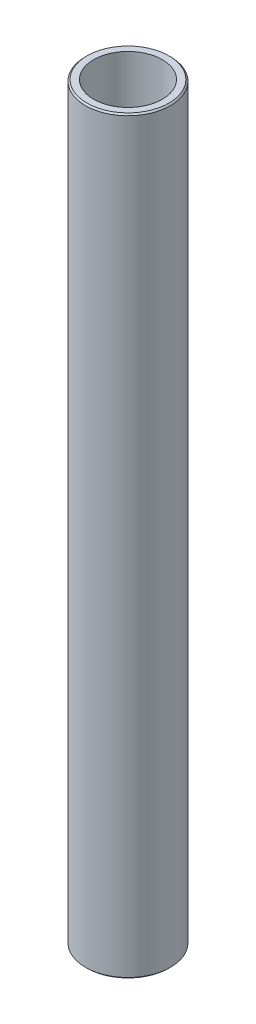
from build123d import *

# Parameters (mm, degrees)
SKETCH1_R           = 20
BOSS_EXTRUDE1_DEPTH = 353.067346771
SKETCH2_R           = 16.193234507
CUT_EXTRUDE1_DEPTH  = 355.198463232
CHAMFER1_SIZE       = 0.69060503


with BuildPart() as part:
    # Sketch1 → Boss-Extrude1 (new body)
    with BuildSketch(Plane(origin=(0, 0, 0), x_dir=(1, 0, 0), z_dir=(0, 1, 0))):
        Circle(SKETCH1_R)
    extrude(amount=BOSS_EXTRUDE1_DEPTH)

    # Sketch2 → Cut-Extrude1 (cut, through all)
    with BuildSketch(Plane(origin=(0, 0, 0), x_dir=(1, 0, 0), z_dir=(0, 1, 0))):
        Circle(SKETCH2_R)
    extrude(amount=CUT_EXTRUDE1_DEPTH, mode=Mode.SUBTRACT)

    # Chamfer1
    chamfer1_edges = [part.edges().sort_by_distance(p)[0] for p in [
        (-20, 353.067346771, 0),
        (-20, 0, 0),
    ]]
    chamfer(chamfer1_edges, length=CHAMFER1_SIZE)


solid = part.part
